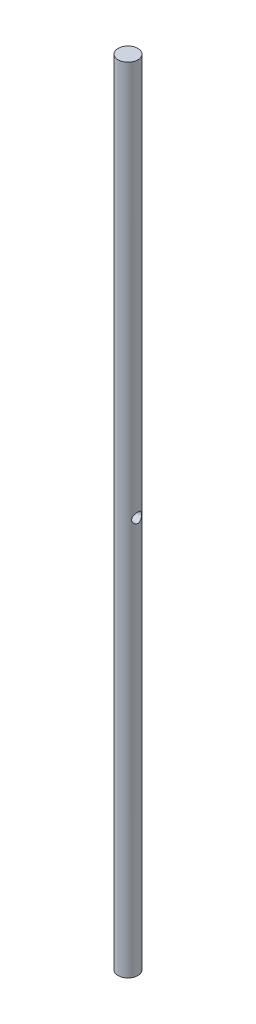
from build123d import *

# Parameters (mm, degrees)
SKETCH1_R               = 1
BOSS_EXTRUDE1_DEPTH     = 80
CUT_EXTRUDE1_DEPTH      = 81.012499024
CUT_EXTRUDE1_DEPTH_BACK = 81.012499024
SKETCH2_R               = 0.5


with BuildPart() as part:
    # Sketch1 → Boss-Extrude1 (new body)
    with BuildSketch(Plane(origin=(0, 0, 0), x_dir=(1, 0, 0), z_dir=(0, 1, 0))):
        Circle(SKETCH1_R)
    extrude(amount=BOSS_EXTRUDE1_DEPTH)

    # Sketch2 → Cut-Extrude1 (cut, two sides: drawn at the far end of the back side and taken through both)
    with BuildSketch(Plane(origin=(0, 0, 0), x_dir=(0, 0, -1), z_dir=(1, 0, 0)).offset(-CUT_EXTRUDE1_DEPTH_BACK)):
        with Locations((0, 40)):
            Circle(SKETCH2_R)
    extrude(amount=CUT_EXTRUDE1_DEPTH + CUT_EXTRUDE1_DEPTH_BACK, mode=Mode.SUBTRACT)


solid = part.part
